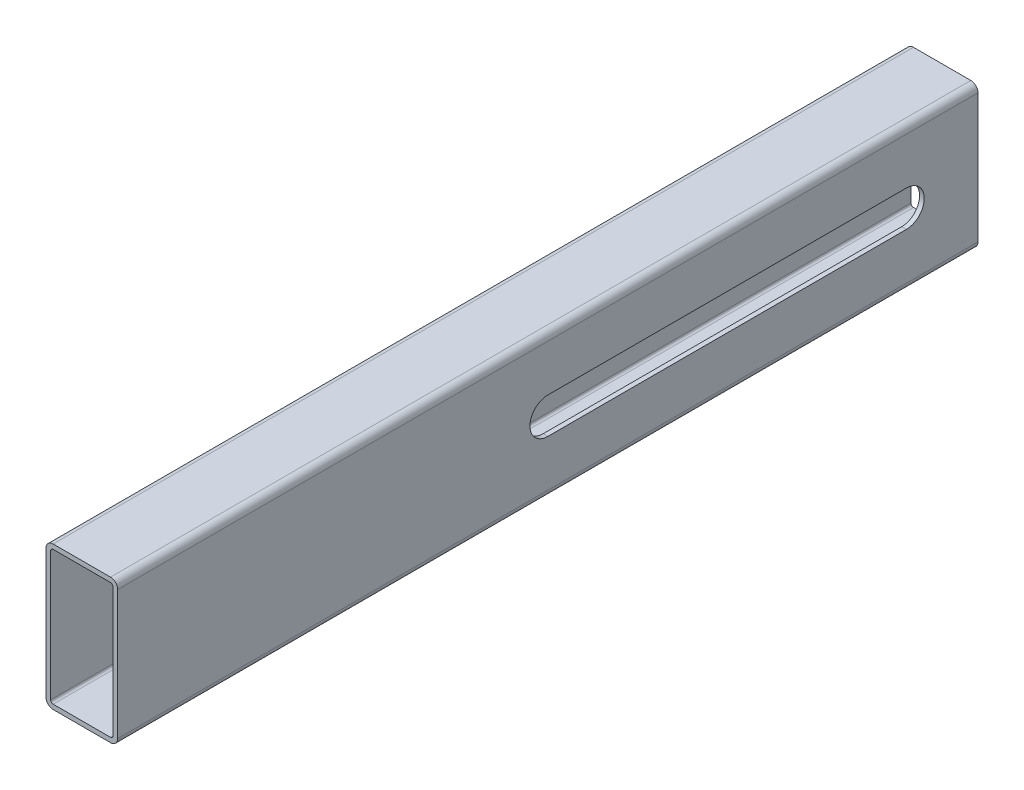
from build123d import *

# Parameters (mm, degrees)
EXTRUDE_THIN1_DEPTH = 304.8
CUT_EXTRUDE1_DEPTH  = 307.909367729


with BuildPart() as part:
    # Sketch1 → Extrude-Thin1 (new body)
    with BuildSketch(Plane.XY):
        with BuildLine():
            Line((-10.16, 25.4), (10.16, 25.4))
            ThreePointArc((10.16, 25.4), (11.956051224, 24.656051224), (12.7, 22.86))
            Line((12.7, 22.86), (12.7, -22.86))
            ThreePointArc((12.7, -22.86), (11.956051224, -24.656051224), (10.16, -25.4))
            Line((10.16, -25.4), (-10.16, -25.4))
            ThreePointArc((-10.16, -25.4), (-11.956051224, -24.656051224), (-12.7, -22.86))
            Line((-12.7, -22.86), (-12.7, 22.86))
            ThreePointArc((-12.7, 22.86), (-11.956051224, 24.656051224), (-10.16, 25.4))
        make_face()
        with BuildLine():
            Line((-10.16, 23.749), (10.16, 23.749))
            ThreePointArc((10.16, 23.749), (10.788617928, 23.488617928), (11.049, 22.86))
            Line((11.049, 22.86), (11.049, -22.86))
            ThreePointArc((11.049, -22.86), (10.788617928, -23.488617928), (10.16, -23.749))
            Line((10.16, -23.749), (-10.16, -23.749))
            ThreePointArc((-10.16, -23.749), (-10.788617928, -23.488617928), (-11.049, -22.86))
            Line((-11.049, -22.86), (-11.049, 22.86))
            ThreePointArc((-11.049, 22.86), (-10.788617928, 23.488617928), (-10.16, 23.749))
        make_face(mode=Mode.SUBTRACT)
    extrude(amount=EXTRUDE_THIN1_DEPTH)

    # Sketch2 → Cut-Extrude1 (cut, through all)
    with BuildSketch(Plane.ZY.offset(12.7)):
        with BuildLine():
            Line((25.4, 6.35), (152.4, 6.35))
            ThreePointArc((152.4, 6.35), (158.75, 0), (152.4, -6.35))
            Line((152.4, -6.35), (25.4, -6.35))
            ThreePointArc((25.4, -6.35), (19.05, 0), (25.4, 6.35))
        make_face()
    extrude(amount=-CUT_EXTRUDE1_DEPTH, mode=Mode.SUBTRACT)


solid = part.part
